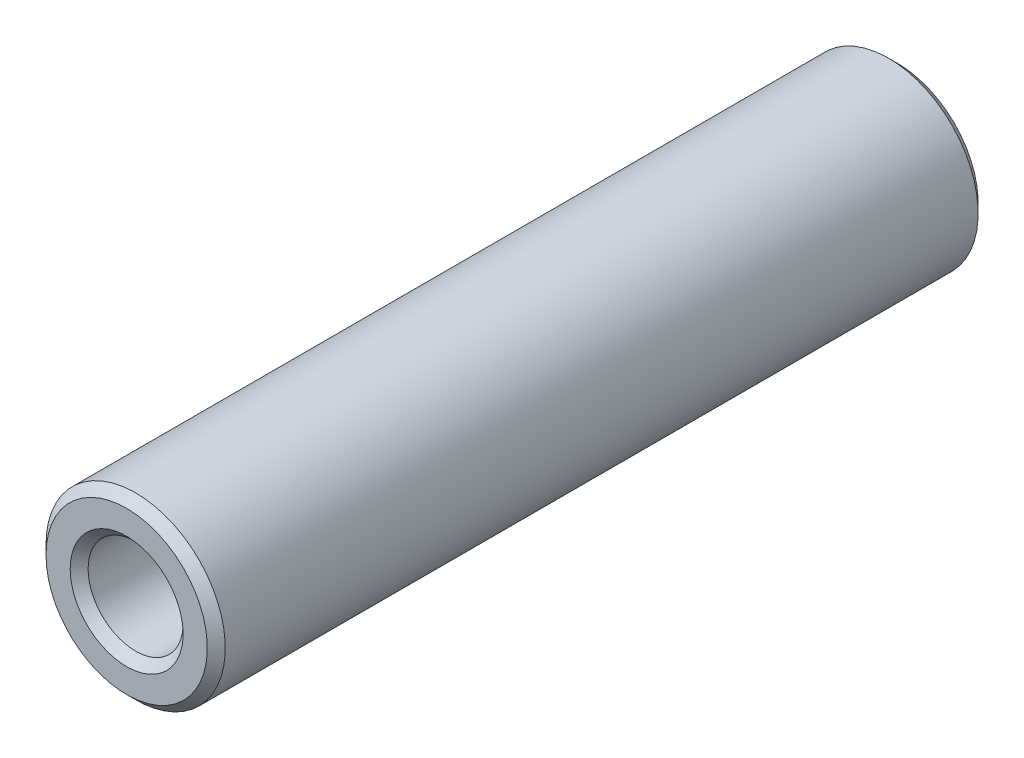
from build123d import *

# Parameters (mm, degrees)
EXTRUDE_THIN1_DEPTH = 6
SKETCH2_R           = 5.65
SKETCH2_R_2         = 2.65
BOSS_EXTRUDE1_DEPTH = 13
BOSS_EXTRUDE2_START = 30
SKETCH3_R           = 5.65
BOSS_EXTRUDE2_DEPTH = 30
CHAMFER1_SIZE       = 0.5
CHAMFER2_SIZE       = 0.5
SKETCH4_R           = 2.65
CUT_EXTRUDE1_DEPTH  = 9
CUT_EXTRUDE2_DEPTH  = 6
CHAMFER3_SIZE       = 0.5
SKETCH8_OUTSIDE_W   = 22.474
SKETCH8_OUTSIDE_H   = 22.474
SKETCH8_OUTSIDE_R   = 5
CUT_EXTRUDE5_DEPTH  = 44.736083501
CHAMFER4_SIZE       = 0.5


with BuildPart() as part:
    # Sketch1 → Extrude-Thin1 (new body)
    with BuildSketch(Plane.XY):
        with BuildLine():
            Line((-1.843908891, 3.15), (1.843908891, 3.15))
            ThreePointArc((1.843908891, 3.15), (0, -3.65), (-1.843908891, 3.15))
        make_face()
        with BuildLine():
            Line((-1.549193338, 2.15), (1.549193338, 2.15))
            ThreePointArc((1.549193338, 2.15), (0, -2.65), (-1.549193338, 2.15))
        make_face(mode=Mode.SUBTRACT)
    extrude(amount=EXTRUDE_THIN1_DEPTH)

    # Sketch2 → Boss-Extrude1 (add)
    with BuildSketch(Plane(origin=(0, 0, 0), x_dir=(-1, 0, 0), z_dir=(0, 0, -1))):
        Circle(SKETCH2_R)
        Circle(SKETCH2_R_2, mode=Mode.SUBTRACT)
    extrude(amount=-BOSS_EXTRUDE1_DEPTH)

    # Sketch3 → Boss-Extrude2 (add)
    with BuildSketch(Plane(origin=(0, 0, 0), x_dir=(-1, 0, 0), z_dir=(0, 0, -1)).offset(BOSS_EXTRUDE2_START)):
        Circle(SKETCH3_R)
    extrude(amount=-BOSS_EXTRUDE2_DEPTH)

    # Chamfer1
    # the kernel refuses this chamfer: 0.5 mm, written as the material it takes off along each edge
    with BuildSketch(Plane(origin=(0, 0, 13), x_dir=(-1, 0, 0), z_dir=(0, -1, 0))) as chamfer1_piece_1:
        Polygon((2.65 + CHAMFER1_SIZE, 0), (2.65, CHAMFER1_SIZE), (2.65, 0), align=None)
    revolve(axis=Axis((0, 0, 13), (0, 0, -1)), mode=Mode.SUBTRACT)

    # Chamfer2
    chamfer2_edges = [part.edges().sort_by_distance(p)[0] for p in [
        (5.65, 0, 13),
    ]]
    chamfer(chamfer2_edges, length=CHAMFER2_SIZE)

    # Sketch4 → Cut-Extrude1 (cut)
    with BuildSketch(Plane(origin=(0, 0, -30), x_dir=(-1, 0, 0), z_dir=(0, 0, -1))):
        Circle(SKETCH4_R)
    extrude(amount=-CUT_EXTRUDE1_DEPTH, mode=Mode.SUBTRACT)

    # Sketch5 → Cut-Extrude2 (cut)
    with BuildSketch(Plane(origin=(0, 0, -21), x_dir=(-1, 0, 0), z_dir=(0, 0, -1))):
        with BuildLine():
            Line((1.549193338, 2.15), (-1.549193338, 2.15))
            ThreePointArc((-1.549193338, 2.15), (-1.207712228, -2.358798672), (2.65, 0))
            ThreePointArc((2.65, 0), (2.358798672, 1.207712228), (1.549193338, 2.15))
        make_face()
    extrude(amount=-CUT_EXTRUDE2_DEPTH, mode=Mode.SUBTRACT)

    # Chamfer3
    chamfer3_edges = [part.edges().sort_by_distance(p)[0] for p in [
        (5.65, 0, -30),
        (2.65, 0, -30),
    ]]
    chamfer(chamfer3_edges, length=CHAMFER3_SIZE)

    # Sketch8 outside → Cut-Extrude5 (cut, through all)
    with BuildSketch(Plane.XY.offset(13)):
        Rectangle(SKETCH8_OUTSIDE_W, SKETCH8_OUTSIDE_H)
        Circle(SKETCH8_OUTSIDE_R, mode=Mode.SUBTRACT)
    extrude(amount=-CUT_EXTRUDE5_DEPTH, mode=Mode.SUBTRACT)

    # Chamfer4
    chamfer4_edges = [part.edges().sort_by_distance(p)[0] for p in [
        (-5, 0, -30),
        (-5, 0, 13),
    ]]
    chamfer(chamfer4_edges, length=CHAMFER4_SIZE)


solid = part.part
